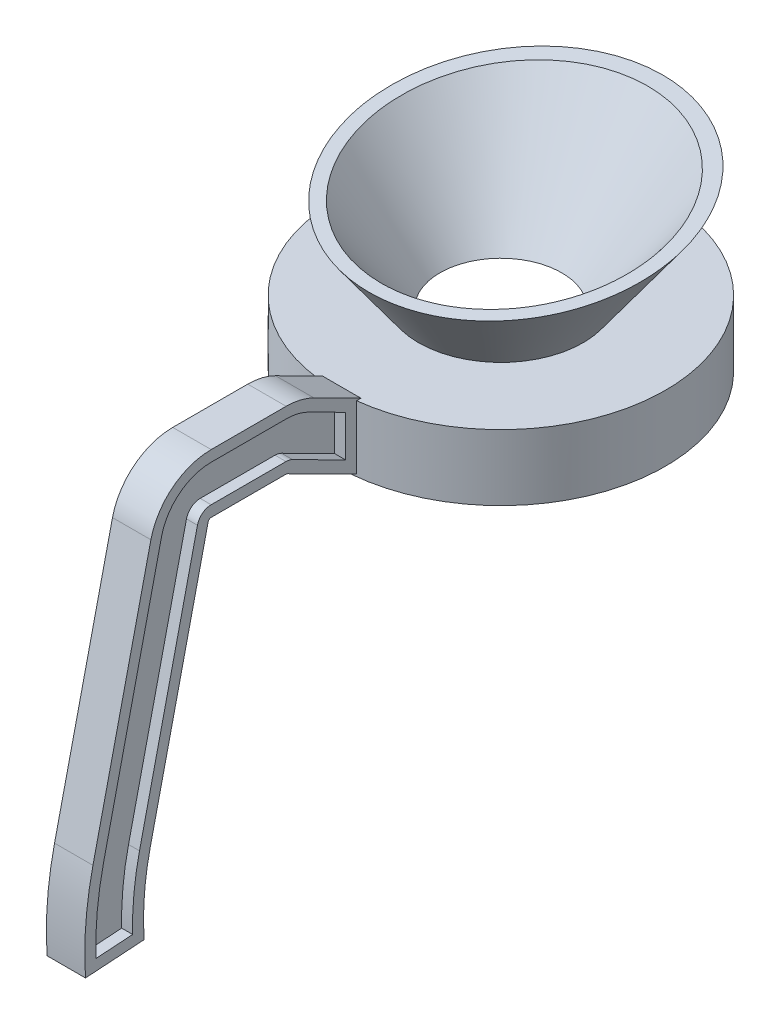
from build123d import *

# Parameters (mm, degrees)
SWEEP2_START       = -8.89
SWEEP2_DEPTH       = 17.78
FILLET1_R          = 28.448
FILLET2_R          = 1.524
CUT_EXTRUDE1_DEPTH = 5.08


with BuildPart() as part:
    # Sketch1 → Revolve1 (revolve)
    with BuildSketch(Plane.XY, mode=Mode.PRIVATE) as revolve1_sk:
        Polygon((71.12, 25.4), (28.194, 25.4), (68.685755738, 81.378294554), (75.018953762, 81.51903327), (38.1, 30.48), (76.2, 30.48), (76.2, 0), (71.12, 0), align=None)
    revolve(revolve1_sk.sketch.rotate(Axis((0, 85.716301318, 0), (0, -1, 0)), 90), axis=Axis((0, 85.716301318, 0), (0, -1, 0)))

    # SurfaceCut1
    split(bisect_by=Plane(origin=(0, 69.471471591, 9.763578605), x_dir=(-1, 0, 0), z_dir=(0, 0.9902680687415703, 0.13917310096006574)), keep=Keep.BOTTOM)

    # Sweep2: read off the stored shape, not the designer's step
    # Sweep2 outline → Sweep2 (add)
    with BuildSketch(Plane.YZ.offset(SWEEP2_START)):
        with BuildLine():
            Line((17.370160471, 143.002), (17.370160471, 107.987503449))
            Line((17.370160471, 107.987503449), (1.021963911, 75.67963993))
            Line((1.021963911, 75.67963993), (30.48, 75.67963993))
            Line((30.48, 75.67963993), (30.48, 73.66))
            Line((30.48, 73.66), (44.566575341, 101.498370543))
            Line((44.566575341, 101.498370543), (44.566575341, 143.002))
            ThreePointArc((44.566575341, 143.002), (38.336028216, 160.835083682), (22.355619148, 170.908073165))
            Line((22.355619148, 170.908073165), (-94.754140244, 197.729788602))
            ThreePointArc((-94.754140244, 197.729788602), (-116.352888931, 201.043440298), (-138.203933305, 201.177947268))
            Line((-138.203933305, 201.177947268), (-136.414333354, 174.040476608))
            ThreePointArc((-136.414333354, 174.040476608), (-118.532403269, 173.934498987), (-100.856344498, 171.226806034))
            Line((-100.856344498, 171.226806034), (16.253414894, 144.405090597))
            ThreePointArc((16.253414894, 144.405090597), (17.056894537, 143.898630346), (17.370160471, 143.002))
        make_face()
    extrude(amount=SWEEP2_DEPTH)

    # Fillet1
    fillet1_edges = [part.edges().sort_by_distance(p)[0] for p in [
        (0, 44.566575341, 101.498370543),
    ]]
    fillet(fillet1_edges, radius=FILLET1_R)

    # Fillet2
    fillet2_edges = [part.edges().sort_by_distance(p)[0] for p in [
        (0, 17.370160471, 107.987503449),
    ]]
    fillet(fillet2_edges, radius=FILLET2_R)

    # Sketch7 → Cut-Extrude1 (cut)
    with BuildSketch(Plane(origin=(8.89, 0, 0), x_dir=(0, 0, -1), z_dir=(1, 0, 0))):
        with BuildLine():
            Line((-80.75963993, 9.28584823), (-80.75963993, 28.379170924))
            Line((-80.75963993, 28.379170924), (-97.73546941, 36.969160074))
            ThreePointArc((-97.73546941, 36.969160074), (-102.862715222, 38.848510317), (-108.286134805, 39.486575341))
            Line((-108.286134805, 39.486575341), (-143.002, 39.486575341))
            ThreePointArc((-143.002, 39.486575341), (-157.670443725, 34.362181678), (-165.956972893, 21.218510727))
            Line((-165.956972893, 21.218510727), (-192.778140508, -95.888856575))
            ThreePointArc((-192.778140508, -95.888856575), (-195.756406443, -114.226762874), (-196.359610136, -132.795150546))
            Line((-196.359610136, -132.795150546), (-179.348953739, -131.673370618))
            ThreePointArc((-179.348953739, -131.673370618), (-178.772717763, -115.597689457), (-176.178592901, -99.722233909))
            Line((-176.178592901, -99.722233909), (-149.355564845, 17.393241513))
            ThreePointArc((-149.355564845, 17.393241513), (-147.062179047, 21.031609572), (-143.002, 22.450160471))
            Line((-143.002, 22.450160471), (-108.351133677, 22.450160471))
            ThreePointArc((-108.351133677, 22.450160471), (-106.818428143, 22.269837747), (-105.369423892, 21.738717026))
            Line((-105.369423892, 21.738717026), (-80.75963993, 9.28584823))
        make_face()
    cut_extrude1 = extrude(amount=-CUT_EXTRUDE1_DEPTH, mode=Mode.SUBTRACT)

    # Mirror2: Cut-Extrude1 across plane
    add(cut_extrude1.mirror(Plane(origin=(0, 0, 0), x_dir=(0, 0, 1), z_dir=(1, 0, 0))), mode=Mode.SUBTRACT)


solid = part.part
